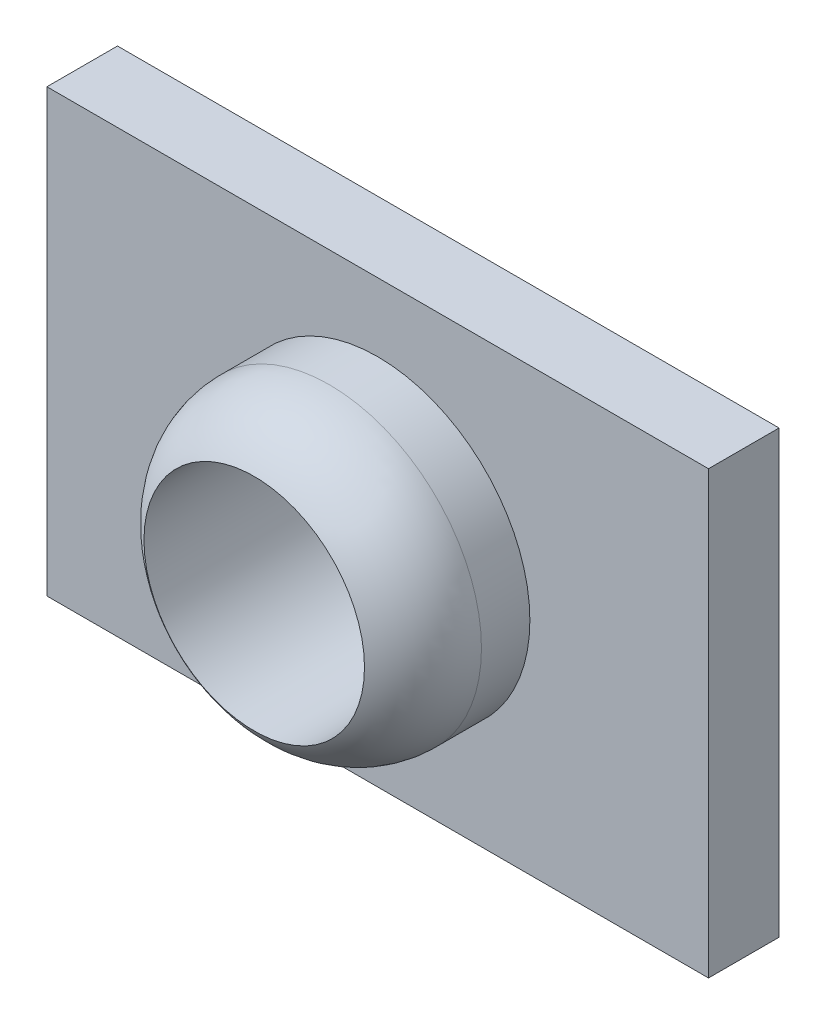
from build123d import *

# Parameters (mm, degrees)
SKETCH1_R           = 3.45
SKETCH1_R_2         = 2.5
BOSS_EXTRUDE1_DEPTH = 4.4
SKETCH1_3_W         = 15
SKETCH1_3_H         = 10
SKETCH1_3_R         = 3.45
BOSS_EXTRUDE2_DEPTH = 1.6
FILLET1_R           = 2


with BuildPart() as part:
    # Sketch1 → Boss-Extrude1 (new body)
    with BuildSketch(Plane.XY):
        Circle(SKETCH1_R)
        Circle(SKETCH1_R_2, mode=Mode.SUBTRACT)
    extrude(amount=BOSS_EXTRUDE1_DEPTH)

    # Sketch1<3> → Boss-Extrude2 (add)
    with BuildSketch(Plane.XY):
        Rectangle(SKETCH1_3_W, SKETCH1_3_H)
        Circle(SKETCH1_3_R, mode=Mode.SUBTRACT)
    extrude(amount=BOSS_EXTRUDE2_DEPTH)

    # Fillet1
    # the kernel refuses this fillet: 2 mm, written as the material it takes off along each edge
    with BuildSketch(Plane(origin=(0, 0, 4.4), x_dir=(1, 0, 0), z_dir=(0, -1, 0))) as fillet1_piece_1:
        with BuildLine():
            CenterArc((1.45, -1.702204453), FILLET1_R, 0, 58.331756746)
            Line((2.5, 0), (2.521, 0.034044089))
            ThreePointArc((2.521, 0.034044089), (2.975, 0.04), (3.45, 0.04))
            Line((3.45, 0.04), (3.49, 0))
            Line((3.49, 0), (3.49, -1.702204453))
            Line((3.49, -1.702204453), (3.45, -1.702204453))
        make_face()
    revolve(axis=Axis((0, 0, 4.4), (0, 0, 1)), mode=Mode.SUBTRACT)


solid = part.part
